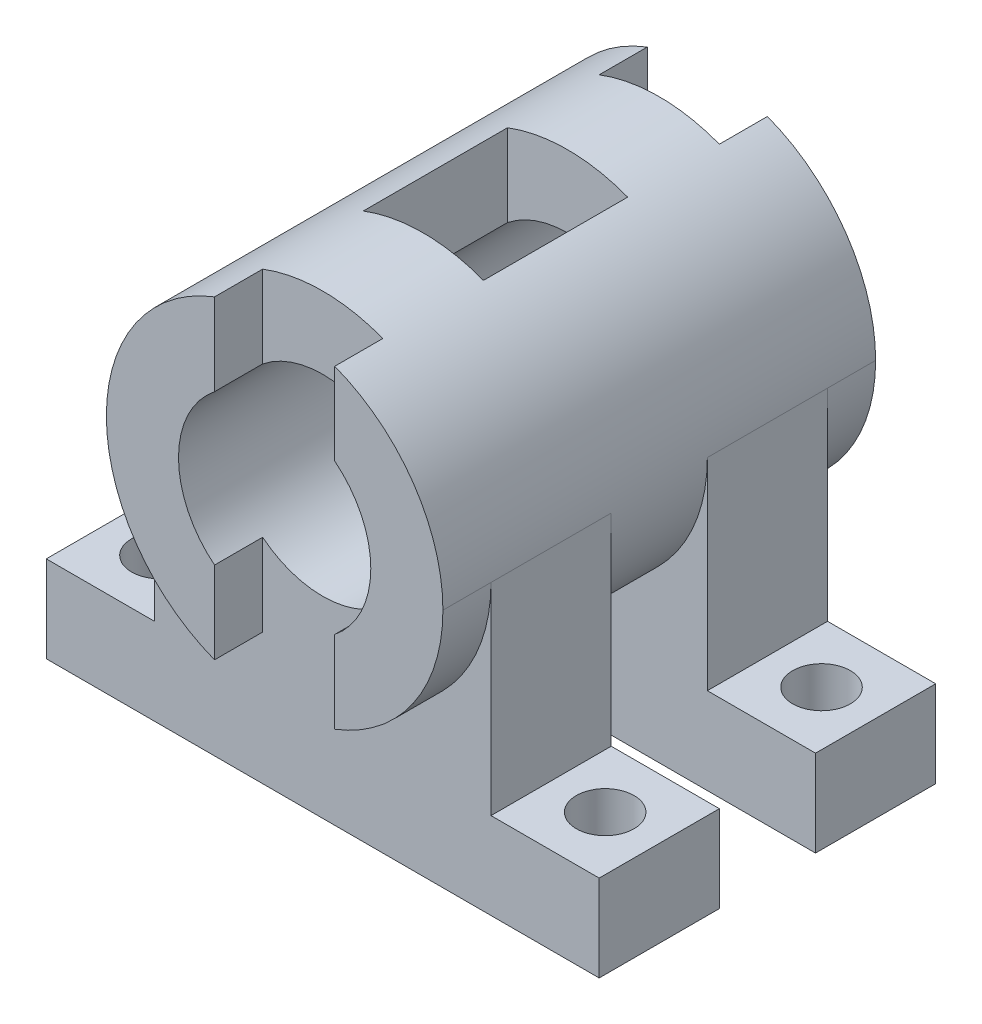
from build123d import *

# Parameters (mm, degrees)
BOSS_EXTRUDE1_DEPTH      = 10
BOSS_EXTRUDE1_DEPTH_BACK = 80
SKETCH1_R                = 35
SKETCH1_R_2              = 20
BOSS_EXTRUDE2_DEPTH      = 25
SKETCH1_6_W              = 25
SKETCH1_6_H              = 110.00683766
CUT_EXTRUDE1_DEPTH       = 137.862156932
SKETCH2_R                = 6
CUT_EXTRUDE2_DEPTH       = 126.040993278
SKETCH3_W                = 25
SKETCH3_H                = 30
CUT_EXTRUDE3_DEPTH       = 116.352719951


with BuildPart() as part:
    # Sketch1 → Boss-Extrude1 (new, two sides: drawn at the far end of the back side and taken through both)
    with BuildSketch(Plane.XY.offset(-BOSS_EXTRUDE1_DEPTH_BACK)):
        with Locations((0, 60)):
            Circle(SKETCH1_R)
        with Locations((0, 60)):
            Circle(SKETCH1_R_2, mode=Mode.SUBTRACT)
    extrude(amount=BOSS_EXTRUDE1_DEPTH + BOSS_EXTRUDE1_DEPTH_BACK)

    # Sketch1<5> → Boss-Extrude2 (add)
    with BuildSketch(Plane.XY):
        with BuildLine():
            Line((-57.5, 18), (-57.5, 0))
            Line((-57.5, 0), (57.5, 0))
            Line((57.5, 0), (57.5, 18))
            Line((57.5, 18), (35, 18))
            Line((35, 18), (35, 60))
            ThreePointArc((35, 60), (0, 25), (-35, 60))
            Line((-35, 60), (-35, 18))
            Line((-35, 18), (-57.5, 18))
        make_face()
    boss_extrude2 = extrude(amount=-BOSS_EXTRUDE2_DEPTH)

    # Sketch1<6> → Cut-Extrude1 (cut, through all)
    with BuildSketch(Plane.XY):
        with Locations((0, 60)):
            Rectangle(SKETCH1_6_W, SKETCH1_6_H)
    cut_extrude1 = extrude(amount=CUT_EXTRUDE1_DEPTH, mode=Mode.SUBTRACT)

    # Mirror1: Boss-Extrude2, Cut-Extrude1 across plane
    add(boss_extrude2.mirror(Plane.XY.offset(-35)))
    add(cut_extrude1.mirror(Plane.XY.offset(-35)), mode=Mode.SUBTRACT)

    # Sketch2 → Cut-Extrude2 (cut, through all)
    with BuildSketch(Plane(origin=(0, 18, 0), x_dir=(1, 0, 0), z_dir=(0, 1, 0))):
        with Locations((-46.25, 12.5)):
            Circle(SKETCH2_R)
        with Locations((-46.25, 57.5)):
            Circle(SKETCH2_R)
        with Locations((46.25, 12.5)):
            Circle(SKETCH2_R)
        with Locations((46.25, 57.5)):
            Circle(SKETCH2_R)
    extrude(amount=-CUT_EXTRUDE2_DEPTH, mode=Mode.SUBTRACT)

    # Sketch3 → Cut-Extrude3 (cut, through all)
    with BuildSketch(Plane(origin=(0, 60, 0), x_dir=(-1, 0, 0), z_dir=(0, -1, 0))):
        with Locations((0, 35.925900751)):
            Rectangle(SKETCH3_W, SKETCH3_H)
    extrude(amount=-CUT_EXTRUDE3_DEPTH, mode=Mode.SUBTRACT)


solid = part.part
